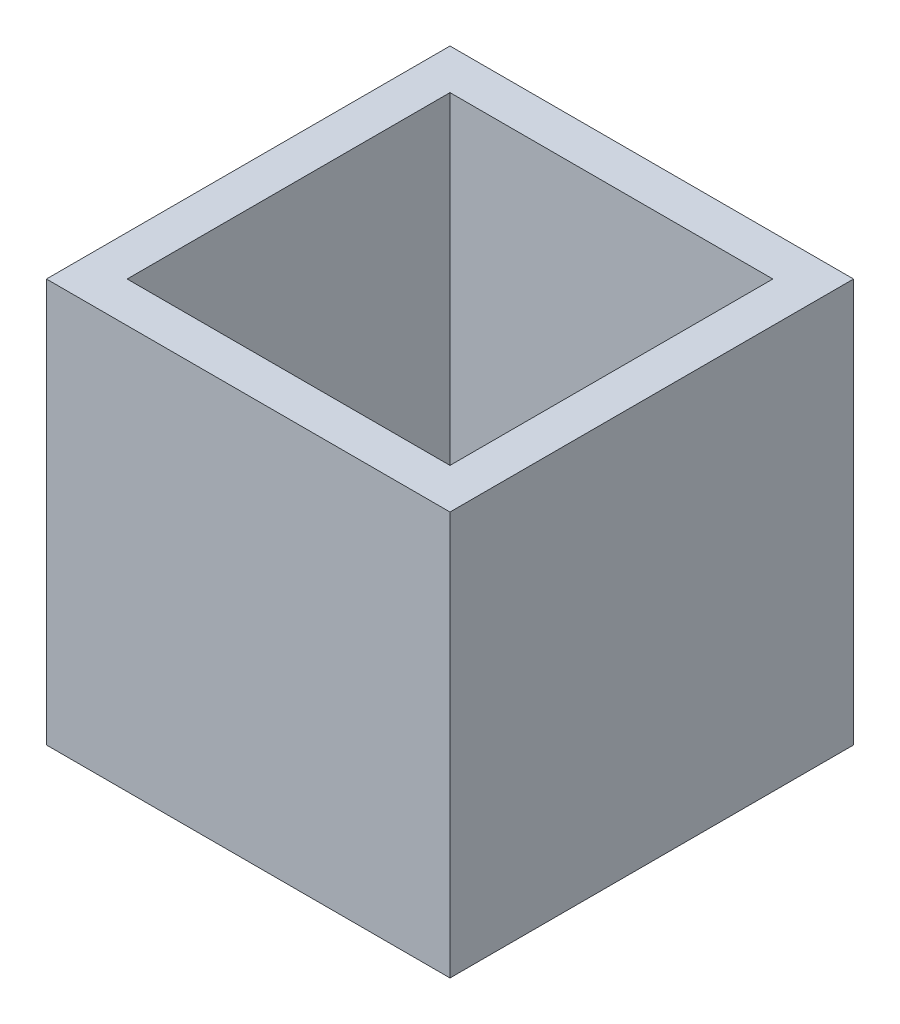
from build123d import *

# Parameters (mm, degrees)
SKETCH1_W           = 2.5
SKETCH1_H           = 2.5
SKETCH1_W_2         = 2
SKETCH1_H_2         = 2
BOSS_EXTRUDE1_DEPTH = 2.5


with BuildPart() as part:
    # Sketch1 → Boss-Extrude1 (new body)
    with BuildSketch(Plane(origin=(0, 0, 0), x_dir=(1, 0, 0), z_dir=(0, 1, 0))):
        Rectangle(SKETCH1_W, SKETCH1_H)
        Rectangle(SKETCH1_W_2, SKETCH1_H_2, mode=Mode.SUBTRACT)
    extrude(amount=BOSS_EXTRUDE1_DEPTH)


solid = part.part
